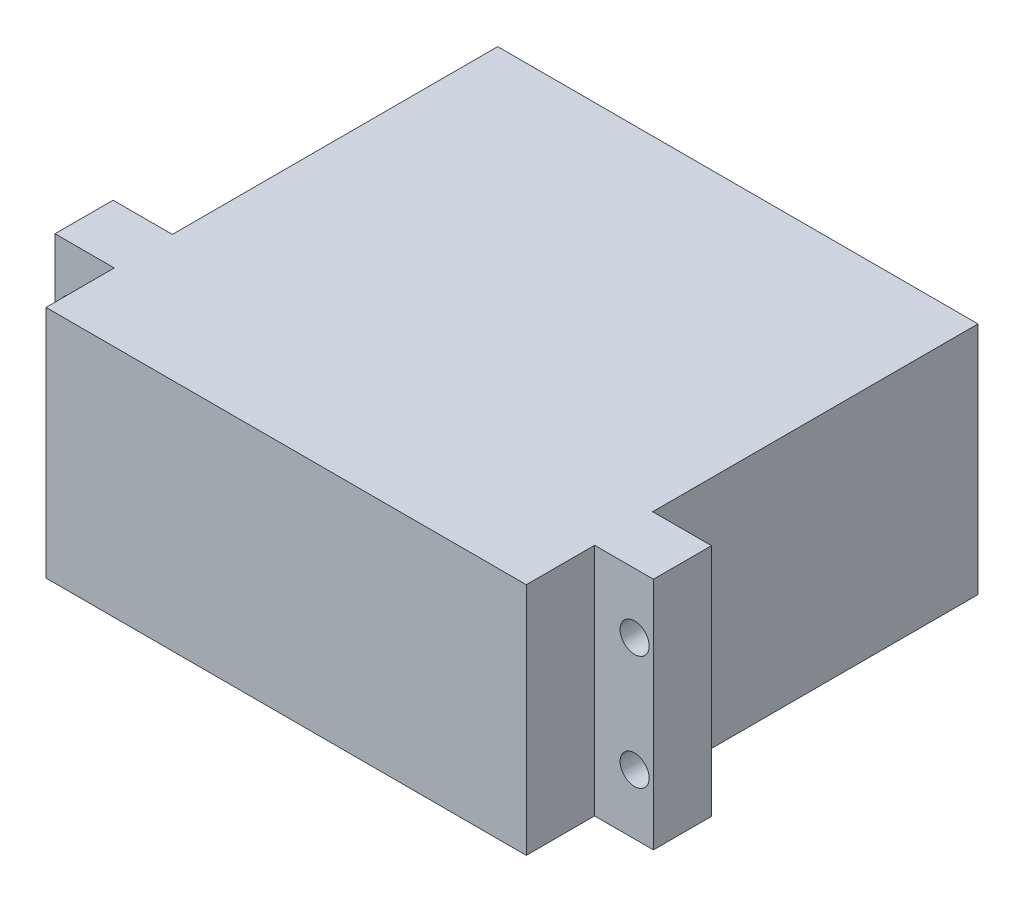
from build123d import *

# Parameters (mm, degrees)
SKETCH1_W           = 42
SKETCH1_H           = 20.5
BOSS_EXTRUDE1_DEPTH = 39.5
SKETCH2_W           = 5.185118418
SKETCH2_H           = 20.5
SKETCH2_R           = 1.27
SKETCH2_W_2         = 5.144602193
BOSS_EXTRUDE2_DEPTH = 5.08


with BuildPart() as part:
    # Sketch1 → Boss-Extrude1 (new body)
    with BuildSketch(Plane.XY):
        with Locations((21, 10.25)):
            Rectangle(SKETCH1_W, SKETCH1_H)
    extrude(amount=BOSS_EXTRUDE1_DEPTH)

    # Sketch2 → Boss-Extrude2 (add)
    # profile 1 of 2: a face of its own
    with BuildSketch(Plane(origin=(0, 0, 28.448), x_dir=(-1, 0, 0), z_dir=(0, 0, -1))):
        with Locations((2.592559209, 10.25)):
            Rectangle(SKETCH2_W, SKETCH2_H)
        with Locations((3.5, 5.25)):
            Circle(SKETCH2_R, mode=Mode.SUBTRACT)
        with Locations((3.5, 15.25)):
            Circle(SKETCH2_R, mode=Mode.SUBTRACT)
    # profile 2 of 2: a face of its own
    with BuildSketch(Plane(origin=(0, 0, 28.448), x_dir=(-1, 0, 0), z_dir=(0, 0, -1))):
        with Locations((-44.572301096, 10.25)):
            Rectangle(SKETCH2_W_2, SKETCH2_H)
        with Locations((-45.5, 5.25)):
            Circle(SKETCH2_R, mode=Mode.SUBTRACT)
        with Locations((-45.5, 15.25)):
            Circle(SKETCH2_R, mode=Mode.SUBTRACT)
    extrude(amount=-BOSS_EXTRUDE2_DEPTH)


solid = part.part
